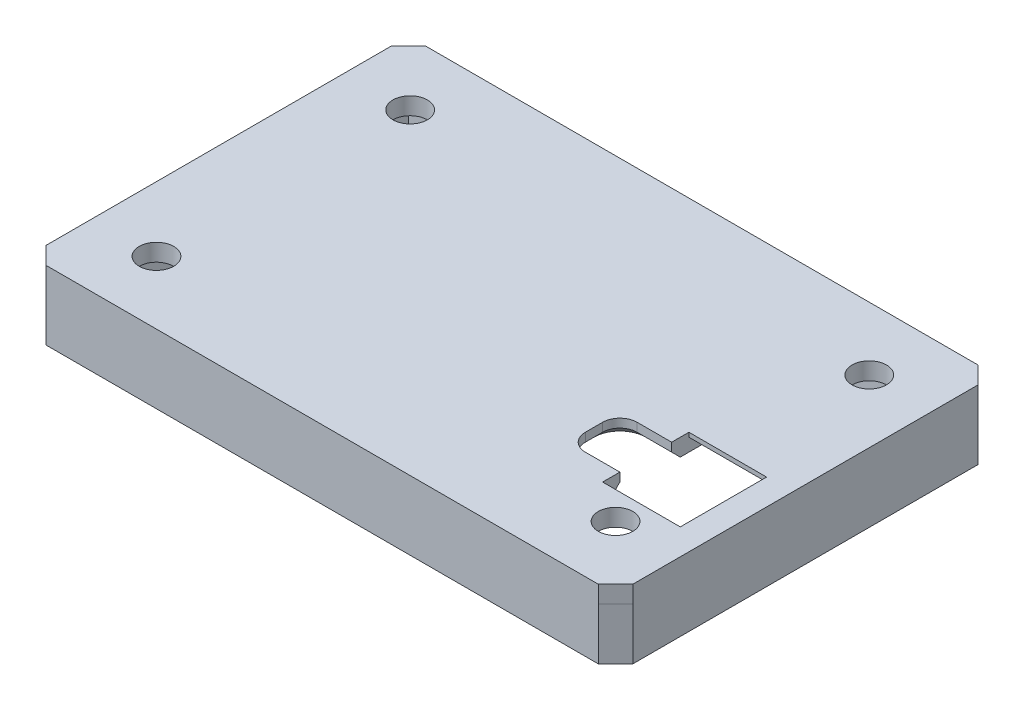
from build123d import *

# Parameters (mm, degrees)
SKETCH1_W            = 68
SKETCH1_H            = 44
BOSS_EXTRUDE1_DEPTH  = 2
SKETCH2_R            = 2
CUT_EXTRUDE1_DEPTH   = 2
SKETCH3_W            = 12
SKETCH3_H            = 23
CUT_EXTRUDE2_DEPTH   = 2
SKETCH4_W            = 3
SKETCH4_H            = 23
BOSS_EXTRUDE2_DEPTH  = 2
SKETCH8_W            = 6
SKETCH8_H            = 12
CUT_EXTRUDE4_DEPTH   = 20
CHAMFER2_SIZE        = 1
CHAMFER4_SIZE        = 2
SKETCH9_W            = 62
SKETCH9_H            = 38
BOSS_EXTRUDE5_DEPTH  = 6
CHAMFER5_SIZE        = 2
SKETCH12_W           = 8.376373975
SKETCH12_H           = 18.223954528
BOSS_EXTRUDE10_DEPTH = 2
SKETCH15_W           = 3
SKETCH15_H           = 1.5
BOSS_EXTRUDE11_DEPTH = 12
CHAMFER7_SIZE        = 1
SKETCH16_W           = 9
SKETCH16_H           = 0.5
BOSS_EXTRUDE12_DEPTH = 11
SKETCH17_W           = 6
SKETCH17_H           = 6
CUT_EXTRUDE5_DEPTH   = 11
FILLET1_R            = 2
SKETCH18_W           = 11
SKETCH18_H           = 3
CUT_EXTRUDE6_DEPTH   = 1
CHAMFER8_SIZE        = 1
SKETCH19_R           = 3.25
CUT_EXTRUDE7_DEPTH   = 11
CUT_EXTRUDE8_DEPTH   = 11
CHAMFER9_SIZE        = 1


with BuildPart() as part:
    # Sketch1 → Boss-Extrude1 (new body)
    with BuildSketch(Plane(origin=(0, 0, 0), x_dir=(1, 0, 0), z_dir=(0, 1, 0))):
        with Locations((4.391941392, -7.446886447)):
            Rectangle(SKETCH1_W, SKETCH1_H)
    extrude(amount=BOSS_EXTRUDE1_DEPTH)

    # Sketch2 → Cut-Extrude1 (cut)
    with BuildSketch(Plane(origin=(0, 2, 0), x_dir=(1, 0, 0), z_dir=(0, 1, 0))):
        with Locations(Location((-22.108058608, 7.253113553, 0), (0, 0, 270))):
            Circle(SKETCH2_R)
        with Locations(Location((31.091941392, 7.253113553, 0), (0, 0, 270))):
            Circle(SKETCH2_R)
        with Locations(Location((31.091941392, -22.146886447, 0), (0, 0, 270))):
            Circle(SKETCH2_R)
        with Locations(Location((-22.108058608, -22.146886447, 0), (0, 0, 270))):
            Circle(SKETCH2_R)
    extrude(amount=-CUT_EXTRUDE1_DEPTH, mode=Mode.SUBTRACT)

    # Sketch3 → Cut-Extrude2 (cut)
    with BuildSketch(Plane(origin=(0, 2, 0), x_dir=(1, 0, 0), z_dir=(0, 1, 0))):
        with Locations((32.391941392, -7.446886447)):
            Rectangle(SKETCH3_W, SKETCH3_H)
    extrude(amount=-CUT_EXTRUDE2_DEPTH, mode=Mode.SUBTRACT)

    # Sketch4 → Boss-Extrude2 (add)
    with BuildSketch(Plane(origin=(0, 2, 0), x_dir=(1, 0, 0), z_dir=(0, 1, 0))):
        with Locations((36.891941392, -7.446886447)):
            Rectangle(SKETCH4_W, SKETCH4_H)
    extrude(amount=-BOSS_EXTRUDE2_DEPTH)

    # Sketch8 → Cut-Extrude4 (cut)
    with BuildSketch(Plane(origin=(0, 2, 0), x_dir=(1, 0, 0), z_dir=(0, 1, 0))):
        with Locations((-26.608058608, -7.446886447)):
            Rectangle(SKETCH8_W, SKETCH8_H)
    extrude(amount=-CUT_EXTRUDE4_DEPTH, mode=Mode.SUBTRACT)

    # Chamfer2
    chamfer2_edges = [part.edges().sort_by_distance(p)[0] for p in [
        (-29.608058608, 1, 13.446886447),
        (-29.608058608, 1, 1.446886447),
    ]]
    chamfer(chamfer2_edges, length=CHAMFER2_SIZE)

    # Chamfer4
    chamfer4_edges = [part.edges().sort_by_distance(p)[0] for p in [
        (-29.608058608, 1, -14.553113553),
        (38.391941392, 1, -14.553113553),
        (38.391941392, 1, 29.446886447),
        (-29.608058608, 1, 29.446886447),
    ]]
    chamfer(chamfer4_edges, length=CHAMFER4_SIZE)

    # Sketch9 → Boss-Extrude5 (add)
    with BuildSketch(Plane.XZ):
        Polygon((-29.608058608, -14.553113553), (38.391941392, -14.553113553), (38.391941392, -11.553113553), (38.391941392, 25.764285426), (38.391941392, 29.446886447), (-29.608058608, 29.446886447), (-29.608058608, 25.764285426), (-29.608058608, -11.553113553), align=None)
        with Locations((4.391941392, 7.446886447)):
            Rectangle(SKETCH9_W, SKETCH9_H, mode=Mode.SUBTRACT)
    extrude(amount=BOSS_EXTRUDE5_DEPTH)

    # Chamfer5
    chamfer5_edges = [part.edges().sort_by_distance(p)[0] for p in [
        (38.391941392, -3, 29.446886447),
        (-29.608058608, -3, 29.446886447),
        (-29.608058608, -3, -14.553113553),
        (38.391941392, -3, -14.553113553),
    ]]
    chamfer(chamfer5_edges, length=CHAMFER5_SIZE - 0.0001)  # a hair under: the kernel refuses the full size

    # Sketch12 → Boss-Extrude10 (add)
    with BuildSketch(Plane(origin=(0, 2, 0), x_dir=(1, 0, 0), z_dir=(0, 1, 0))):
        with Locations((-25.419871621, -7.493021435)):
            Rectangle(SKETCH12_W, SKETCH12_H)
    extrude(amount=-BOSS_EXTRUDE10_DEPTH)

    # Sketch15 → Boss-Extrude11 (add)
    with BuildSketch(Plane(origin=(26.391941392, 0, 0), x_dir=(0, 0, -1), z_dir=(1, 0, 0))):
        with Locations((-7.446886447, 1.25)):
            Rectangle(SKETCH15_W, SKETCH15_H)
    extrude(amount=BOSS_EXTRUDE11_DEPTH)

    # Chamfer7
    chamfer7_edges = [part.edges().sort_by_distance(p)[0] for p in [
        (30.891941392, 0.5, 8.946886447),
        (30.891941392, 0.5, 5.946886447),
    ]]
    chamfer(chamfer7_edges, length=CHAMFER7_SIZE)

    # Sketch16 → Boss-Extrude12 (add)
    with BuildSketch(Plane(origin=(0, 0, 5.946886447), x_dir=(-1, 0, 0), z_dir=(0, 0, -1))):
        with Locations((-30.891941392, 1.75)):
            Rectangle(SKETCH16_W, SKETCH16_H)
    extrude(amount=BOSS_EXTRUDE12_DEPTH)

    # Sketch17 → Cut-Extrude5 (cut)
    with BuildSketch(Plane(origin=(0, 2, 0), x_dir=(1, 0, 0), z_dir=(0, 1, 0))):
        with Locations((23.391941392, -13.946886447)):
            Rectangle(SKETCH17_W, SKETCH17_H)
    extrude(amount=-CUT_EXTRUDE5_DEPTH, mode=Mode.SUBTRACT)

    # Fillet1
    fillet1_edges = [part.edges().sort_by_distance(p)[0] for p in [
        (20.391941392, 1, 16.946886447),
        (20.391941392, 1, 10.946886447),
    ]]
    fillet(fillet1_edges, radius=FILLET1_R)

    # Sketch18 → Cut-Extrude6 (cut)
    with BuildSketch(Plane.ZY.offset(29.608058608)):
        with Locations((7.446886447, -4.5)):
            Rectangle(SKETCH18_W, SKETCH18_H)
    extrude(amount=-CUT_EXTRUDE6_DEPTH, mode=Mode.SUBTRACT)

    # Chamfer8
    chamfer8_edges = [part.edges().sort_by_distance(p)[0] for p in [
        (-29.608058608, -4.5, 12.946886447),
        (-29.608058608, -3, 7.446886447),
        (-29.608058608, -4.5, 1.946886447),
    ]]
    chamfer(chamfer8_edges, length=CHAMFER8_SIZE - 0.0001)  # a hair under: the kernel refuses the full size

    # Sketch19 → Cut-Extrude7 (cut)
    with BuildSketch(Plane.ZY.offset(28.608058608)):
        with Locations((7.446886447, -8.4)):
            Circle(SKETCH19_R)
    extrude(amount=-CUT_EXTRUDE7_DEPTH, mode=Mode.SUBTRACT)

    # Sketch20 → Cut-Extrude8 (cut)
    with BuildSketch(Plane(origin=(0, 0, -14.553113553), x_dir=(-1, 0, 0), z_dir=(0, 0, -1))):
        with BuildLine():
            Line((-23.141941392, -2.75), (-23.141941392, -6))
            Line((-23.141941392, -6), (-17.641941392, -6))
            Line((-17.641941392, -6), (-17.641941392, -2.75))
            ThreePointArc((-17.641941392, -2.75), (-20.391941392, 0), (-23.141941392, -2.75))
        make_face()
    extrude(amount=-CUT_EXTRUDE8_DEPTH, mode=Mode.SUBTRACT)

    # Chamfer9
    chamfer9_edges = [part.edges().sort_by_distance(p)[0] for p in [
        (24.391941392, 0, 10.946886447),
        (20.391941392, 0, 13.946886447),
        (24.391941392, 0, 16.946886447),
        (20.97772783, 0, 11.532672885),
        (20.97772783, 0, 16.361100009),
    ]]
    chamfer(chamfer9_edges, length=CHAMFER9_SIZE)


solid = part.part
